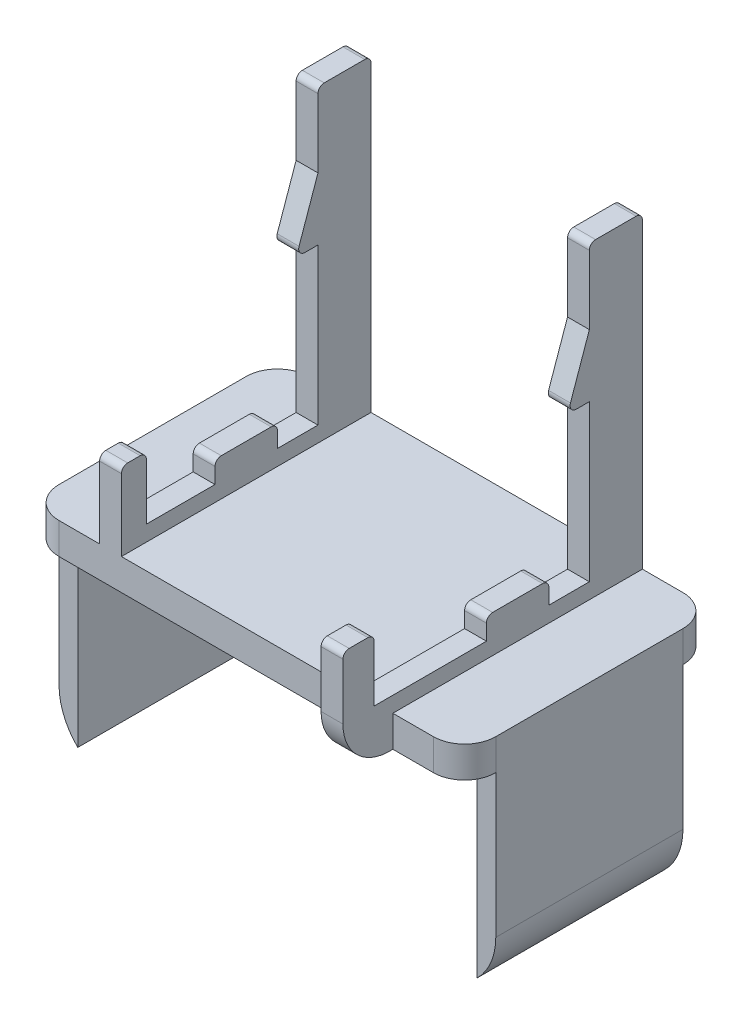
from build123d import *

# Parameters (mm, degrees)
BOSS_EXTRUDE1_DEPTH = 5
SKETCH2_W           = 3
SKETCH2_H           = 30
BOSS_EXTRUDE2_DEPTH = 30
FILLET1_R           = 10
BOSS_EXTRUDE3_DEPTH = 3.5
BOSS_EXTRUDE4_DEPTH = 3.5
FILLET2_R           = 1


with BuildPart() as part:
    # Sketch1 → Boss-Extrude1 (new body)
    with BuildSketch(Plane(origin=(0, 0, 0), x_dir=(1, 0, 0), z_dir=(0, 1, 0))):
        with BuildLine():
            Line((5, 0), (65, 0))
            ThreePointArc((65, 0), (68.535533906, 1.464466094), (70, 5))
            Line((70, 5), (70, 35))
            ThreePointArc((70, 35), (68.535533906, 38.535533906), (65, 40))
            Line((65, 40), (5, 40))
            ThreePointArc((5, 40), (1.464466094, 38.535533906), (0, 35))
            Line((0, 35), (0, 5))
            ThreePointArc((0, 5), (1.464466094, 1.464466094), (5, 0))
        make_face()
    extrude(amount=BOSS_EXTRUDE1_DEPTH)

    # Sketch2 → Boss-Extrude2 (add)
    with BuildSketch(Plane.XZ):
        with Locations((1.5, -20)):
            Rectangle(SKETCH2_W, SKETCH2_H)
        with Locations((68.5, -20)):
            Rectangle(SKETCH2_W, SKETCH2_H)
    extrude(amount=BOSS_EXTRUDE2_DEPTH)

    # Fillet1
    # the kernel refuses this fillet: 10 mm, written as the material it takes off along each edge
    with BuildSketch(Plane(origin=(0, -30, -52.853571071), x_dir=(0, 1, 0), z_dir=(0, 0, 1))) as fillet1_piece_1:
        with BuildLine():
            CenterArc((7.141428429, -10), FILLET1_R, 90, 45.572995999)
            Line((0, -3), (-0.142828569, -2.86))
            ThreePointArc((-0.142828569, -2.86), (-0.2, -1.5), (-0.2, 0))
            Line((-0.2, 0), (0, 0.2))
            Line((0, 0.2), (7.141428429, 0.2))
            Line((7.141428429, 0.2), (7.141428429, 0))
        make_face()
    extrude(amount=65.707142143, mode=Mode.SUBTRACT)
    with BuildSketch(Plane(origin=(70, -30, -52.853571071), x_dir=(0, 1, 0), z_dir=(0, 0, 1))) as fillet1_piece_2:
        with BuildLine():
            CenterArc((7.141428429, 10), FILLET1_R, 224.427004001, 45.572995999)
            Line((0, 3), (-0.142828569, 2.86))
            ThreePointArc((-0.142828569, 2.86), (-0.2, 1.5), (-0.2, 0))
            Line((-0.2, 0), (0, -0.2))
            Line((0, -0.2), (7.141428429, -0.2))
            Line((7.141428429, -0.2), (7.141428429, 0))
        make_face()
    extrude(amount=65.707142143, mode=Mode.SUBTRACT)

    # Sketch3 → Boss-Extrude3 (add)
    with BuildSketch(Plane.ZY.offset(-15)):
        Polygon((-25, 7.5), (-31.5, 7.5), (-31.5, 32.5), (-28, 32.5), (-31.5, 42.5), (-31.5, 54.5), (-40, 54.5), (-40, 5), (0, 5), (0, 17.5), (-4, 17.5), (-4, 7.5), (-15, 7.5), (-15, 11), (-25, 11), align=None)
    extrude(amount=BOSS_EXTRUDE3_DEPTH)

    # Sketch4 → Boss-Extrude4 (add)
    with BuildSketch(Plane.ZY.offset(-55)):
        with BuildLine():
            Line((-31.5, 7.5), (-31.5, 32.5))
            Line((-31.5, 32.5), (-28, 32.5))
            Line((-28, 32.5), (-31.5, 42.5))
            Line((-31.5, 42.5), (-31.5, 54.5))
            Line((-31.5, 54.5), (-40, 54.5))
            Line((-40, 54.5), (-40, 5))
            Line((-40, 5), (0, 5))
            Line((0, 5), (0, 0))
            ThreePointArc((0, 0), (5.624620047, 2.01707195), (8, 7.5))
            Line((8, 7.5), (8, 17.5))
            Line((8, 17.5), (3, 17.5))
            Line((3, 17.5), (3, 7.5))
            Line((3, 7.5), (-15, 7.5))
            Line((-15, 7.5), (-15, 11))
            Line((-15, 11), (-25, 11))
            Line((-25, 11), (-25, 7.5))
            Line((-25, 7.5), (-31.5, 7.5))
        make_face()
    extrude(amount=-BOSS_EXTRUDE4_DEPTH)

    # Fillet2
    fillet2_edges = [part.edges().sort_by_distance(p)[0] for p in [
        (56.75, 17.5, 3),
        (56.75, 17.5, 8),
        (56.75, 54.5, -40),
        (56.75, 54.5, -31.5),
        (56.75, 32.5, -28),
        (13.25, 54.5, -31.5),
        (13.25, 54.5, -40),
        (13.25, 17.5, 0),
        (13.25, 17.5, -4),
        (13.25, 11, -15),
        (13.25, 11, -25),
        (13.25, 32.5, -28),
        (56.75, 11, -25),
        (56.75, 11, -15),
    ]]
    fillet(fillet2_edges, radius=FILLET2_R)


solid = part.part
